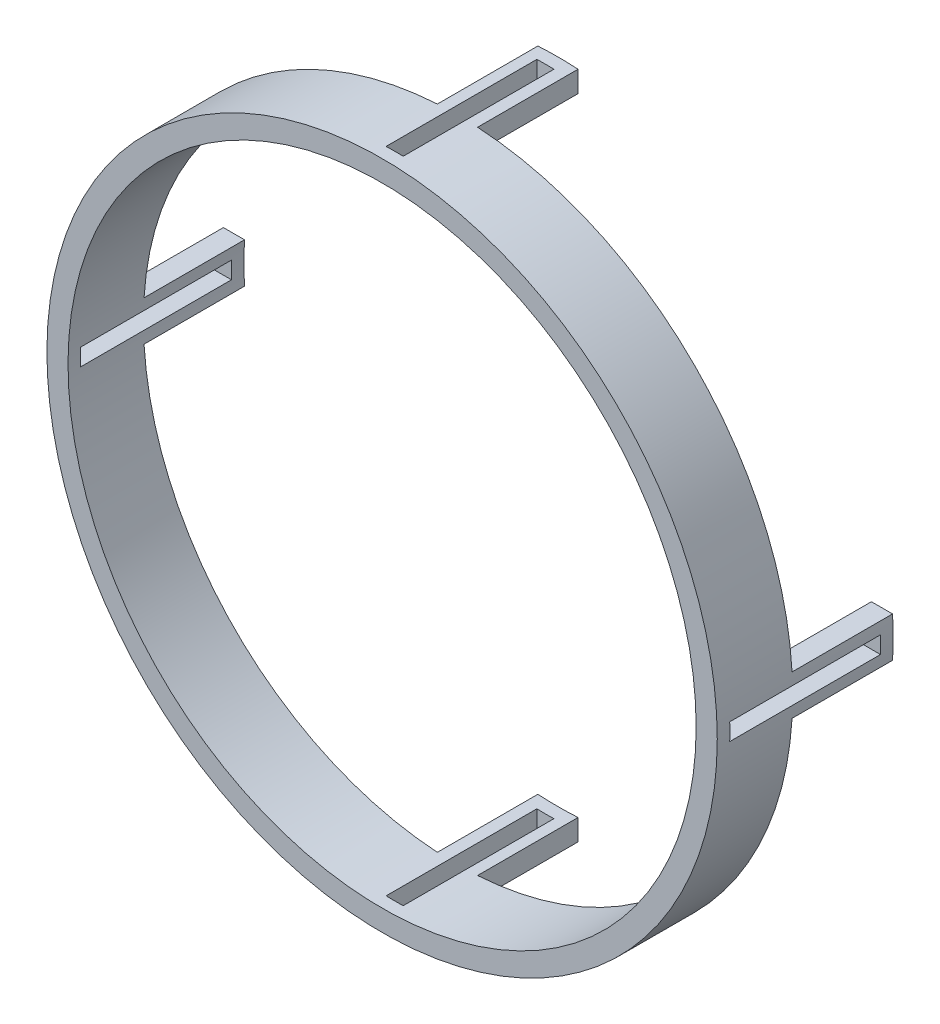
from build123d import *
from build123d.topology import SkipClean

# Parameters (mm, degrees)
SKETCH1_R           = 84.709
SKETCH1_R_2         = 79.375
BOSS_EXTRUDE1_DEPTH = 19.05
BOSS_EXTRUDE2_START = 25.4
BOSS_EXTRUDE2_DEPTH = 25.4
SKETCH2_W           = 4.318
SKETCH2_H           = 38.1
CUT_EXTRUDE1_DEPTH  = 123.459745884
CIRPATTERN1_COUNT   = 4


with BuildPart() as part:
    # Sketch1 → Boss-Extrude1 (new body)
    with BuildSketch(Plane.XY):
        Circle(SKETCH1_R)
        Circle(SKETCH1_R_2, mode=Mode.SUBTRACT)
    extrude(amount=BOSS_EXTRUDE1_DEPTH)

    # Sketch3 → Boss-Extrude2 (add)
    with SkipClean():  # the faces are left unmerged after this step: merging them gives an invalid solid
        with BuildSketch(Plane(origin=(0, 0, 0), x_dir=(-1, 0, 0), z_dir=(0, 0, -1)).offset(BOSS_EXTRUDE2_START)):
            with BuildLine():
                Line((-5.08, 79.212273197), (-5.08, 84.556538961))
                ThreePointArc((-5.08, 84.556538961), (0, 84.709), (5.08, 84.556538961))
                Line((5.08, 84.556538961), (5.08, 79.212273197))
                ThreePointArc((5.08, 79.212273197), (0, 79.375), (-5.08, 79.212273197))
            make_face()
            with BuildLine():
                Line((-5.08, -79.212273197), (-5.08, -84.556538961))
                ThreePointArc((-5.08, -84.556538961), (0, -84.709), (5.08, -84.556538961))
                Line((5.08, -84.556538961), (5.08, -79.212273197))
                ThreePointArc((5.08, -79.212273197), (0, -79.375), (-5.08, -79.212273197))
            make_face()
            with BuildLine():
                Line((79.212273197, -5.08), (84.556538961, -5.08))
                ThreePointArc((84.556538961, -5.08), (84.709, 0), (84.556538961, 5.08))
                Line((84.556538961, 5.08), (79.212273197, 5.08))
                ThreePointArc((79.212273197, 5.08), (79.375, 0), (79.212273197, -5.08))
            make_face()
            with BuildLine():
                Line((-79.212273197, 5.08), (-84.556538961, 5.08))
                ThreePointArc((-84.556538961, 5.08), (-84.709, 0), (-84.556538961, -5.08))
                Line((-84.556538961, -5.08), (-79.212273197, -5.08))
                ThreePointArc((-79.212273197, -5.08), (-79.375, 0), (-79.212273197, 5.08))
            make_face()
        extrude(amount=-BOSS_EXTRUDE2_DEPTH)

    # Sketch2 → Cut-Extrude1 (cut, through all)
    with SkipClean():  # the faces are left unmerged after this step: merging them gives an invalid solid
        with BuildSketch(Plane(origin=(0, 0, 0), x_dir=(1, 0, 0), z_dir=(0, 1, 0))):
            with Locations((0, 3.175)):
                Rectangle(SKETCH2_W, SKETCH2_H)
        cut_extrude1 = extrude(amount=-CUT_EXTRUDE1_DEPTH, mode=Mode.SUBTRACT)

    # CirPattern1: Cut-Extrude1 ×4 about axis
    with SkipClean():  # the faces are left unmerged after this step: merging them gives an invalid solid
        cirpattern1_axis = Axis((0, 0, 2.080715754), (0, 0, 1))
        for i in range(1, CIRPATTERN1_COUNT):
            add(cut_extrude1.rotate(cirpattern1_axis, i * 360 / CIRPATTERN1_COUNT), mode=Mode.SUBTRACT)


solid = part.part
